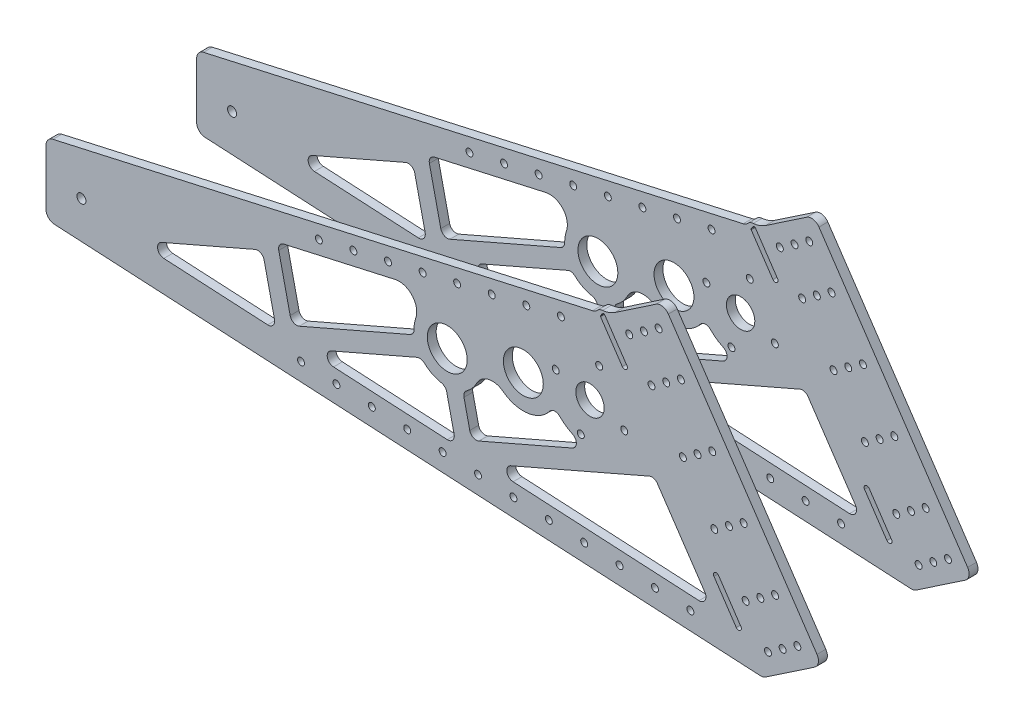
from build123d import *

# Parameters (mm, degrees)
BEARING_BLOCK_INTERFACE_PLATE_R   = 2.489199999999945
BEARING_BLOCK_INTERFACE_PLATE_R_2 = 2.4891999999999532
BEARING_BLOCK_INTERFACE_PLATE_R_3 = 2.4891999999998307
BOSS_EXTRUDE1_DEPTH               = 6.35
FILLET2_R                         = 6.35
PLATE_GB_R                        = 2.489199999999945
PLATE_GB_R_2                      = 2.4891999999998307
PLATE_GB_R_3                      = 14.287500000000026
PLATE_GB_R_4                      = 2.4891999999999532
PLATE_GB_R_5                      = 14.287500000000149
PLATE_GB_R_6                      = 2.4892000000000594
PLATE_GB_R_7                      = 10.159999999999924
PLATE_GB_R_8                      = 2.4891999999996024
BOSS_EXTRUDE2_DEPTH               = 6.35
FILLET1_R                         = 6.35
CUT_EXTRUDE1_REACH                = 774.478
TUBE_R                            = 3.2639000000000062
TUBE_R_2                          = 2.4891999999998307
TUBE_R_3                          = 2.4891999999999532
TUBE_R_4                          = 2.489199999999945
CUT_EXTRUDE2_REACH                = 774.478
FILLET3_R                         = 4.7625
FILLET4_R                         = 0.635


with BuildPart() as part:
    # bearing block interface plate → Boss-Extrude1 (new body)
    with BuildSketch(Plane.XY.offset(57.15000000000033)):
        Polygon((529.0514377657089, 336.1483946681548), (571.1665464508059, 364.5553941639975), (684.7945444360628, 196.0949594208139), (642.6794357509659, 167.6879599249711), align=None)
        with Locations((646.1064630479871, 185.31848697026268)):
            Circle(BEARING_BLOCK_INTERFACE_PLATE_R, mode=Mode.SUBTRACT)
        with Locations((656.635240219436, 192.42023684434122)):
            Circle(BEARING_BLOCK_INTERFACE_PLATE_R, mode=Mode.SUBTRACT)
        with Locations((667.164017390885, 199.5219867184198)):
            Circle(BEARING_BLOCK_INTERFACE_PLATE_R, mode=Mode.SUBTRACT)
        with Locations((567.7395191537848, 346.92486711870583)):
            Circle(BEARING_BLOCK_INTERFACE_PLATE_R_2, mode=Mode.SUBTRACT)
        with Locations((557.2107419823359, 339.8231172446273)):
            Circle(BEARING_BLOCK_INTERFACE_PLATE_R_2, mode=Mode.SUBTRACT)
        with Locations((546.6819648108869, 332.7213673705488)):
            Circle(BEARING_BLOCK_INTERFACE_PLATE_R_3, mode=Mode.SUBTRACT)
        with Locations((562.6609020275637, 309.03161873478854)):
            Circle(BEARING_BLOCK_INTERFACE_PLATE_R_3, mode=Mode.SUBTRACT)
        with Locations((573.189679199013, 316.133368608867)):
            Circle(BEARING_BLOCK_INTERFACE_PLATE_R_2, mode=Mode.SUBTRACT)
        with Locations((583.7184563704618, 323.2351184829455)):
            Circle(BEARING_BLOCK_INTERFACE_PLATE_R_2, mode=Mode.SUBTRACT)
        with Locations((606.2073309717106, 289.8939907733571)):
            Circle(BEARING_BLOCK_INTERFACE_PLATE_R_2, mode=Mode.SUBTRACT)
        with Locations((595.6785538002617, 282.7922408992787)):
            Circle(BEARING_BLOCK_INTERFACE_PLATE_R_2, mode=Mode.SUBTRACT)
        with Locations((585.1497766288124, 275.69049102520023)):
            Circle(BEARING_BLOCK_INTERFACE_PLATE_R_3, mode=Mode.SUBTRACT)
        with Locations((628.6962055729593, 256.55286306376865)):
            Circle(BEARING_BLOCK_INTERFACE_PLATE_R_2, mode=Mode.SUBTRACT)
        with Locations((618.1674284015103, 249.45111318969037)):
            Circle(BEARING_BLOCK_INTERFACE_PLATE_R_2, mode=Mode.SUBTRACT)
        with Locations((607.638651230061, 242.3493633156119)):
            Circle(BEARING_BLOCK_INTERFACE_PLATE_R_3, mode=Mode.SUBTRACT)
        with Locations((651.1850801742079, 223.21173535418063)):
            Circle(BEARING_BLOCK_INTERFACE_PLATE_R, mode=Mode.SUBTRACT)
        with Locations((640.656303002759, 216.1099854801021)):
            Circle(BEARING_BLOCK_INTERFACE_PLATE_R, mode=Mode.SUBTRACT)
        with Locations((630.1275258313098, 209.00823560602365)):
            Circle(BEARING_BLOCK_INTERFACE_PLATE_R_3, mode=Mode.SUBTRACT)
    extrude(amount=-BOSS_EXTRUDE1_DEPTH)

    # Fillet2
    fillet2_edges = [part.edges().sort_by_distance(p)[0] for p in [
        (642.6794357509659, 167.6879599249711, 53.975000000000335),
        (571.1665464508059, 364.5553941639975, 53.975000000000335),
        (529.0514377657089, 336.1483946681548, 53.975000000000335),
        (684.7945444360628, 196.0949594208139, 53.975000000000335),
    ]]
    fillet(fillet2_edges, radius=FILLET2_R)

    # plate+gb → Boss-Extrude2 (add)
    with BuildSketch(Plane.XY.offset(57.15000000000033)):
        with BuildLine():
            Line((128.73734233150986, 246.1260000000246), (128.73734233150986, 195.32600000002458))
            Line((128.73734233150986, 195.32600000002458), (642.6794357509659, 167.6879599249711))
            Line((642.6794357509659, 167.6879599249711), (684.7945444360628, 196.0949594208139))
            Line((684.7945444360628, 196.0949594208139), (571.1665464508058, 364.5553941639974))
            Line((571.1665464508058, 364.5553941639974), (536.5393493982891, 341.1990548376937))
            ThreePointArc((536.5393493982891, 341.19905483769367), (532.27553378646, 339.04547668364233), (527.6100125053204, 338.02032615200346))
            ThreePointArc((527.6100125053204, 338.02032615200335), (524.7494784778174, 337.0010093937264), (522.735638532723, 334.7281015091546))
            Line((522.735638532723, 334.7281015091547), (128.73734233150986, 246.1260000000246))
        make_face()
        with BuildLine():
            Line((541.7142246921655, 310.2218744185116), (525.976365604832, 333.55421002934514))
            ThreePointArc((525.9763656048323, 333.55421002934526), (526.9975356247328, 335.313412133839), (528.4731202472173, 336.7134943728115))
            ThreePointArc((528.4731202472174, 336.7134943728114), (528.7911345943266, 336.46047504727386), (529.0514377657092, 336.14839466815505))
            Line((529.0514377657091, 336.148394668155), (545.0303749823858, 312.45864603239465))
            ThreePointArc((545.0303749823858, 312.4586460323946), (544.490685644217, 309.6821850803432), (541.7142246921655, 310.22187441851156))
        make_face(mode=Mode.SUBTRACT)
        with Locations((646.1064630479871, 185.31848697026268)):
            Circle(PLATE_GB_R, mode=Mode.SUBTRACT)
        with BuildLine():
            ThreePointArc((607.4054110273914, 212.83068558260925), (607.94510036556, 215.60714653466047), (610.7215613176113, 215.06745719649211))
            Line((610.7215613176113, 215.0674571964921), (626.7004985342884, 191.37770856073158))
            ThreePointArc((626.7004985342884, 191.37770856073155), (626.1608091961198, 188.60124760867996), (623.3843482440682, 189.14093694684863))
            Line((623.3843482440683, 189.14093694684865), (607.4054110273914, 212.83068558260925))
        make_face(mode=Mode.SUBTRACT)
        with Locations((656.635240219436, 192.42023684434122)):
            Circle(PLATE_GB_R, mode=Mode.SUBTRACT)
        with Locations((667.164017390885, 199.5219867184198)):
            Circle(PLATE_GB_R, mode=Mode.SUBTRACT)
        with Locations((630.1275258313098, 209.00823560602365)):
            Circle(PLATE_GB_R_2, mode=Mode.SUBTRACT)
        with Locations((640.656303002759, 216.1099854801021)):
            Circle(PLATE_GB_R, mode=Mode.SUBTRACT)
        with Locations((416.28658066690326, 258.72124542384995)):
            Circle(PLATE_GB_R_3, mode=Mode.SUBTRACT)
        with Locations((511.9960146960638, 253.34148401228222)):
            Circle(PLATE_GB_R_4, mode=Mode.SUBTRACT)
        with Locations((651.1850801742079, 223.21173535418063)):
            Circle(PLATE_GB_R, mode=Mode.SUBTRACT)
        with Locations((607.638651230061, 242.3493633156119)):
            Circle(PLATE_GB_R_2, mode=Mode.SUBTRACT)
        with Locations((618.1674284015103, 249.45111318969037)):
            Circle(PLATE_GB_R_4, mode=Mode.SUBTRACT)
        with Locations((628.6962055729593, 256.55286306376865)):
            Circle(PLATE_GB_R_4, mode=Mode.SUBTRACT)
        with Locations((470.8050615222699, 270.9813288339667)):
            Circle(PLATE_GB_R_5, mode=Mode.SUBTRACT)
        with Locations((543.1045344294101, 271.3019962544207)):
            Circle(PLATE_GB_R_6, mode=Mode.SUBTRACT)
        with Locations((518.5700184416677, 277.8760000000246)):
            Circle(PLATE_GB_R_7, mode=Mode.SUBTRACT)
        with Locations((494.03550245392535, 284.45000374562846)):
            Circle(PLATE_GB_R_8, mode=Mode.SUBTRACT)
        with Locations((525.1440221872716, 302.410515987767)):
            Circle(PLATE_GB_R_2, mode=Mode.SUBTRACT)
        with Locations((585.1497766288124, 275.69049102520023)):
            Circle(PLATE_GB_R_2, mode=Mode.SUBTRACT)
        with Locations((595.6785538002617, 282.7922408992787)):
            Circle(PLATE_GB_R_4, mode=Mode.SUBTRACT)
        with Locations((606.2073309717106, 289.8939907733571)):
            Circle(PLATE_GB_R_4, mode=Mode.SUBTRACT)
        with Locations((562.6609020275637, 309.03161873478854)):
            Circle(PLATE_GB_R_2, mode=Mode.SUBTRACT)
        with Locations((573.189679199013, 316.133368608867)):
            Circle(PLATE_GB_R_4, mode=Mode.SUBTRACT)
        with Locations((583.7184563704618, 323.2351184829455)):
            Circle(PLATE_GB_R_4, mode=Mode.SUBTRACT)
        with Locations((546.6819648108869, 332.7213673705488)):
            Circle(PLATE_GB_R_2, mode=Mode.SUBTRACT)
        with Locations((557.2107419823359, 339.8231172446273)):
            Circle(PLATE_GB_R_4, mode=Mode.SUBTRACT)
        with Locations((567.7395191537848, 346.92486711870583)):
            Circle(PLATE_GB_R_4, mode=Mode.SUBTRACT)
    extrude(amount=-BOSS_EXTRUDE2_DEPTH)

    # Fillet1
    fillet1_edges = [part.edges().sort_by_distance(p)[0] for p in [
        (128.73734233150986, 195.32600000002458, 53.975000000000335),
        (128.73734233150986, 246.1260000000246, 53.975000000000335),
        (571.1665464508058, 364.5553941639974, 53.975000000000335),
        (642.6794357509659, 167.6879599249711, 53.975000000000335),
        (684.7945444360628, 196.0949594208139, 53.975000000000335),
        (522.735638532723, 334.72810150915467, 53.975000000000335),
    ]]
    fillet(fillet1_edges, radius=FILLET1_R)

    # tube → Cut-Extrude1 (cut, up to next)
    with BuildSketch(Plane.XY.offset(57.15000000000033), mode=Mode.PRIVATE) as cut_extrude1_sk1:
        with Locations((154.13734233150987, 220.7260000000245)):
            Circle(TUBE_R)
    cut_extrude1_tool1 = extrude(cut_extrude1_sk1.sketch, amount=-CUT_EXTRUDE1_REACH, mode=Mode.PRIVATE) & part.part
    # tube → Cut-Extrude1 (cut, up to next)
    with BuildSketch(Plane.XY.offset(57.15000000000033), mode=Mode.PRIVATE) as cut_extrude1_sk2:
        with Locations((497.7285010763347, 319.34163846208315)):
            Circle(TUBE_R_2)
    cut_extrude1_tool2 = extrude(cut_extrude1_sk2.sketch, amount=-CUT_EXTRUDE1_REACH, mode=Mode.PRIVATE) & part.part
    # tube → Cut-Extrude1 (cut, up to next)
    with BuildSketch(Plane.XY.offset(57.15000000000033), mode=Mode.PRIVATE) as cut_extrude1_sk3:
        with Locations((472.9473734148044, 313.76887327566646)):
            Circle(TUBE_R_3)
    cut_extrude1_tool3 = extrude(cut_extrude1_sk3.sketch, amount=-CUT_EXTRUDE1_REACH, mode=Mode.PRIVATE) & part.part
    # tube → Cut-Extrude1 (cut, up to next)
    with BuildSketch(Plane.XY.offset(57.15000000000033), mode=Mode.PRIVATE) as cut_extrude1_sk4:
        with Locations((448.16624575327415, 308.1961080892497)):
            Circle(TUBE_R_3)
    cut_extrude1_tool4 = extrude(cut_extrude1_sk4.sketch, amount=-CUT_EXTRUDE1_REACH, mode=Mode.PRIVATE) & part.part
    # tube → Cut-Extrude1 (cut, up to next)
    with BuildSketch(Plane.XY.offset(57.15000000000033), mode=Mode.PRIVATE) as cut_extrude1_sk5:
        with Locations((423.38511809174383, 302.62334290283303)):
            Circle(TUBE_R_3)
    cut_extrude1_tool5 = extrude(cut_extrude1_sk5.sketch, amount=-CUT_EXTRUDE1_REACH, mode=Mode.PRIVATE) & part.part
    # tube → Cut-Extrude1 (cut, up to next)
    with BuildSketch(Plane.XY.offset(57.15000000000033), mode=Mode.PRIVATE) as cut_extrude1_sk6:
        with Locations((398.60399043021357, 297.05057771641634)):
            Circle(TUBE_R_3)
    cut_extrude1_tool6 = extrude(cut_extrude1_sk6.sketch, amount=-CUT_EXTRUDE1_REACH, mode=Mode.PRIVATE) & part.part
    # tube → Cut-Extrude1 (cut, up to next)
    with BuildSketch(Plane.XY.offset(57.15000000000033), mode=Mode.PRIVATE) as cut_extrude1_sk7:
        with Locations((373.82286276868325, 291.47781252999965)):
            Circle(TUBE_R_2)
    cut_extrude1_tool7 = extrude(cut_extrude1_sk7.sketch, amount=-CUT_EXTRUDE1_REACH, mode=Mode.PRIVATE) & part.part
    # tube → Cut-Extrude1 (cut, up to next)
    with BuildSketch(Plane.XY.offset(57.15000000000033), mode=Mode.PRIVATE) as cut_extrude1_sk8:
        with Locations((590.5082808024525, 183.21189582536667)):
            Circle(TUBE_R_4)
    cut_extrude1_tool8 = extrude(cut_extrude1_sk8.sketch, amount=-CUT_EXTRUDE1_REACH, mode=Mode.PRIVATE) & part.part
    # tube → Cut-Extrude1 (cut, up to next)
    with BuildSketch(Plane.XY.offset(57.15000000000033), mode=Mode.PRIVATE) as cut_extrude1_sk9:
        with Locations((565.144928704245, 184.5758497624026)):
            Circle(TUBE_R_4)
    cut_extrude1_tool9 = extrude(cut_extrude1_sk9.sketch, amount=-CUT_EXTRUDE1_REACH, mode=Mode.PRIVATE) & part.part
    # tube → Cut-Extrude1 (cut, up to next)
    with BuildSketch(Plane.XY.offset(57.15000000000033), mode=Mode.PRIVATE) as cut_extrude1_sk10:
        with Locations((539.7815766060377, 185.93980369943853)):
            Circle(TUBE_R_4)
    cut_extrude1_tool10 = extrude(cut_extrude1_sk10.sketch, amount=-CUT_EXTRUDE1_REACH, mode=Mode.PRIVATE) & part.part
    # tube → Cut-Extrude1 (cut, up to next)
    with BuildSketch(Plane.XY.offset(57.15000000000033), mode=Mode.PRIVATE) as cut_extrude1_sk11:
        with Locations((514.4182245078301, 187.30375763647444)):
            Circle(TUBE_R_4)
    cut_extrude1_tool11 = extrude(cut_extrude1_sk11.sketch, amount=-CUT_EXTRUDE1_REACH, mode=Mode.PRIVATE) & part.part
    # tube → Cut-Extrude1 (cut, up to next)
    with BuildSketch(Plane.XY.offset(57.15000000000033), mode=Mode.PRIVATE) as cut_extrude1_sk12:
        with Locations((489.05487240962265, 188.66771157351036)):
            Circle(TUBE_R_4)
    cut_extrude1_tool12 = extrude(cut_extrude1_sk12.sketch, amount=-CUT_EXTRUDE1_REACH, mode=Mode.PRIVATE) & part.part
    # tube → Cut-Extrude1 (cut, up to next)
    with BuildSketch(Plane.XY.offset(57.15000000000033), mode=Mode.PRIVATE) as cut_extrude1_sk13:
        with Locations((463.6915203114152, 190.03166551054628)):
            Circle(TUBE_R_4)
    cut_extrude1_tool13 = extrude(cut_extrude1_sk13.sketch, amount=-CUT_EXTRUDE1_REACH, mode=Mode.PRIVATE) & part.part
    # tube → Cut-Extrude1 (cut, up to next)
    with BuildSketch(Plane.XY.offset(57.15000000000033), mode=Mode.PRIVATE) as cut_extrude1_sk14:
        with Locations((438.32816821320773, 191.39561944758222)):
            Circle(TUBE_R_4)
    cut_extrude1_tool14 = extrude(cut_extrude1_sk14.sketch, amount=-CUT_EXTRUDE1_REACH, mode=Mode.PRIVATE) & part.part
    # tube → Cut-Extrude1 (cut, up to next)
    with BuildSketch(Plane.XY.offset(57.15000000000033), mode=Mode.PRIVATE) as cut_extrude1_sk15:
        with Locations((412.96481611500025, 192.75957338461814)):
            Circle(TUBE_R_4)
    cut_extrude1_tool15 = extrude(cut_extrude1_sk15.sketch, amount=-CUT_EXTRUDE1_REACH, mode=Mode.PRIVATE) & part.part
    # tube → Cut-Extrude1 (cut, up to next)
    with BuildSketch(Plane.XY.offset(57.15000000000033), mode=Mode.PRIVATE) as cut_extrude1_sk16:
        with Locations((387.6014640167928, 194.12352732165405)):
            Circle(TUBE_R_4)
    cut_extrude1_tool16 = extrude(cut_extrude1_sk16.sketch, amount=-CUT_EXTRUDE1_REACH, mode=Mode.PRIVATE) & part.part
    # tube → Cut-Extrude1 (cut, up to next)
    with BuildSketch(Plane.XY.offset(57.15000000000033), mode=Mode.PRIVATE) as cut_extrude1_sk17:
        with Locations((362.23811191858533, 195.48748125868997)):
            Circle(TUBE_R_4)
    cut_extrude1_tool17 = extrude(cut_extrude1_sk17.sketch, amount=-CUT_EXTRUDE1_REACH, mode=Mode.PRIVATE) & part.part
    # tube → Cut-Extrude1 (cut, up to next)
    with BuildSketch(Plane.XY.offset(57.15000000000033), mode=Mode.PRIVATE) as cut_extrude1_sk18:
        with Locations((336.87475982037785, 196.8514351957259)):
            Circle(TUBE_R_4)
    cut_extrude1_tool18 = extrude(cut_extrude1_sk18.sketch, amount=-CUT_EXTRUDE1_REACH, mode=Mode.PRIVATE) & part.part
    # tube → Cut-Extrude1 (cut, up to next)
    with BuildSketch(Plane.XY.offset(57.15000000000033), mode=Mode.PRIVATE) as cut_extrude1_sk19:
        with Locations((311.5114077221704, 198.21538913276183)):
            Circle(TUBE_R_4)
    cut_extrude1_tool19 = extrude(cut_extrude1_sk19.sketch, amount=-CUT_EXTRUDE1_REACH, mode=Mode.PRIVATE) & part.part
    # tube → Cut-Extrude1 (cut, up to next)
    with BuildSketch(Plane.XY.offset(57.15000000000033), mode=Mode.PRIVATE) as cut_extrude1_sk20:
        with Locations((349.04173510715304, 285.90504734358296)):
            Circle(TUBE_R_2)
    cut_extrude1_tool20 = extrude(cut_extrude1_sk20.sketch, amount=-CUT_EXTRUDE1_REACH, mode=Mode.PRIVATE) & part.part
    # tube → Cut-Extrude1 (cut, up to next)
    with BuildSketch(Plane.XY.offset(57.15000000000033), mode=Mode.PRIVATE) as cut_extrude1_sk21:
        with Locations((324.2606074456227, 280.3322821571662)):
            Circle(TUBE_R_3)
    cut_extrude1_tool21 = extrude(cut_extrude1_sk21.sketch, amount=-CUT_EXTRUDE1_REACH, mode=Mode.PRIVATE) & part.part
    add(cut_extrude1_tool1.solids().sort_by_distance((154.137342, 220.726, 57.15))[0], mode=Mode.SUBTRACT)
    add(cut_extrude1_tool2.solids().sort_by_distance((497.728501, 319.341638, 57.15))[0], mode=Mode.SUBTRACT)
    add(cut_extrude1_tool3.solids().sort_by_distance((472.947373, 313.768873, 57.15))[0], mode=Mode.SUBTRACT)
    add(cut_extrude1_tool4.solids().sort_by_distance((448.166246, 308.196108, 57.15))[0], mode=Mode.SUBTRACT)
    add(cut_extrude1_tool5.solids().sort_by_distance((423.385118, 302.623343, 57.15))[0], mode=Mode.SUBTRACT)
    add(cut_extrude1_tool6.solids().sort_by_distance((398.60399, 297.050578, 57.15))[0], mode=Mode.SUBTRACT)
    add(cut_extrude1_tool7.solids().sort_by_distance((373.822863, 291.477813, 57.15))[0], mode=Mode.SUBTRACT)
    add(cut_extrude1_tool8.solids().sort_by_distance((590.508281, 183.211896, 57.15))[0], mode=Mode.SUBTRACT)
    add(cut_extrude1_tool9.solids().sort_by_distance((565.144929, 184.57585, 57.15))[0], mode=Mode.SUBTRACT)
    add(cut_extrude1_tool10.solids().sort_by_distance((539.781577, 185.939804, 57.15))[0], mode=Mode.SUBTRACT)
    add(cut_extrude1_tool11.solids().sort_by_distance((514.418225, 187.303758, 57.15))[0], mode=Mode.SUBTRACT)
    add(cut_extrude1_tool12.solids().sort_by_distance((489.054872, 188.667712, 57.15))[0], mode=Mode.SUBTRACT)
    add(cut_extrude1_tool13.solids().sort_by_distance((463.69152, 190.031666, 57.15))[0], mode=Mode.SUBTRACT)
    add(cut_extrude1_tool14.solids().sort_by_distance((438.328168, 191.395619, 57.15))[0], mode=Mode.SUBTRACT)
    add(cut_extrude1_tool15.solids().sort_by_distance((412.964816, 192.759573, 57.15))[0], mode=Mode.SUBTRACT)
    add(cut_extrude1_tool16.solids().sort_by_distance((387.601464, 194.123527, 57.15))[0], mode=Mode.SUBTRACT)
    add(cut_extrude1_tool17.solids().sort_by_distance((362.238112, 195.487481, 57.15))[0], mode=Mode.SUBTRACT)
    add(cut_extrude1_tool18.solids().sort_by_distance((336.87476, 196.851435, 57.15))[0], mode=Mode.SUBTRACT)
    add(cut_extrude1_tool19.solids().sort_by_distance((311.511408, 198.215389, 57.15))[0], mode=Mode.SUBTRACT)
    add(cut_extrude1_tool20.solids().sort_by_distance((349.041735, 285.905047, 57.15))[0], mode=Mode.SUBTRACT)
    add(cut_extrude1_tool21.solids().sort_by_distance((324.260607, 280.332282, 57.15))[0], mode=Mode.SUBTRACT)

    # Sketch20 → Cut-Extrude2 (cut, up to next)
    with BuildSketch(Plane.XY.offset(57.15000000000033), mode=Mode.PRIVATE) as cut_extrude2_sk1:
        Polygon((283.7782182408136, 253.59394234449184), (193.02712039136657, 214.1258298591775), (293.87334152601755, 208.70266655571493), align=None)
    cut_extrude2_tool1 = extrude(cut_extrude2_sk1.sketch, amount=-CUT_EXTRUDE2_REACH, mode=Mode.PRIVATE) & part.part
    # Sketch20 → Cut-Extrude2 (cut, up to next)
    with BuildSketch(Plane.XY.offset(57.15000000000033), mode=Mode.PRIVATE) as cut_extrude2_sk2:
        with BuildLine():
            Line((397.7730730126499, 243.7450913586069), (314.6314269698162, 207.58636803741302))
            Line((314.6314269698162, 207.58636803741308), (422.5826597553713, 201.78112161747538))
            Line((422.58265975537137, 201.7811216174754), (415.1265819839163, 234.93701620982114))
            ThreePointArc((415.126581983916, 234.93701620982102), (405.5089529197121, 237.48735985401194), (397.77307301264995, 243.74509135860666))
        make_face()
    cut_extrude2_tool2 = extrude(cut_extrude2_sk2.sketch, amount=-CUT_EXTRUDE2_REACH, mode=Mode.PRIVATE) & part.part
    # Sketch20 → Cut-Extrude2 (cut, up to next)
    with BuildSketch(Plane.XY.offset(57.15000000000033), mode=Mode.PRIVATE) as cut_extrude2_sk3:
        with BuildLine():
            Line((304.9718820421919, 217.2344544602027), (392.70805195930586, 255.3913595046347))
            ThreePointArc((392.7080519593054, 255.39135950463523), (392.57852746394303, 260.94910753260035), (393.741172300006, 266.38542951740084))
            ThreePointArc((393.7411723000059, 266.38542951740084), (391.16240743211694, 278.96260089462623), (378.93057191111905, 282.86355819805976))
            Line((378.93057191111905, 282.8635581980597), (294.4837853667419, 263.87321528118673))
            Line((294.483785366742, 263.87321528118673), (304.9718820421919, 217.2344544602027))
        make_face()
    cut_extrude2_tool3 = extrude(cut_extrude2_sk3.sketch, amount=-CUT_EXTRUDE2_REACH, mode=Mode.PRIVATE) & part.part
    # Sketch20 → Cut-Extrude2 (cut, up to next)
    with BuildSketch(Plane.XY.offset(57.15000000000033), mode=Mode.PRIVATE) as cut_extrude2_sk4:
        Polygon((564.6938350728718, 253.44189704181008), (443.3407451991701, 200.66482309917347), (606.1997655838906, 191.9068245043722), align=None)
    cut_extrude2_tool4 = extrude(cut_extrude2_sk4.sketch, amount=-CUT_EXTRUDE2_REACH, mode=Mode.PRIVATE) & part.part
    # Sketch20 → Cut-Extrude2 (cut, up to next)
    with BuildSketch(Plane.XY.offset(57.15000000000033), mode=Mode.PRIVATE) as cut_extrude2_sk5:
        with BuildLine():
            ThreePointArc((437.4277117876691, 247.7627906429703), (433.232938002764, 241.99234440509446), (427.5171458146811, 237.7233988030291))
            Line((427.51714581468167, 237.72339880302906), (433.6812002715457, 210.31290952196312))
            Line((433.6812002715457, 210.31290952196312), (519.7296081727479, 247.7357983101625))
            ThreePointArc((519.7296081727479, 247.73579831016238), (504.36792965000797, 251.2662822224191), (492.8846159595747, 262.0634573334294))
            ThreePointArc((492.88461595957466, 262.0634573334294), (477.11936489850655, 248.0212606911487), (456.39066165040543, 252.02716748127182))
            ThreePointArc((456.39066165040543, 252.0271674812718), (445.9165991255359, 254.30884525726637), (437.4277117876691, 247.7627906429703))
        make_face()
    cut_extrude2_tool5 = extrude(cut_extrude2_sk5.sketch, amount=-CUT_EXTRUDE2_REACH, mode=Mode.PRIVATE) & part.part
    add(cut_extrude2_tool1.solids().sort_by_distance((256.892893, 225.474146, 57.15))[0], mode=Mode.SUBTRACT)
    add(cut_extrude2_tool2.solids().sort_by_distance((381.543889, 218.429138, 57.15))[0], mode=Mode.SUBTRACT)
    add(cut_extrude2_tool3.solids().sort_by_distance((342.159835, 254.458367, 57.15))[0], mode=Mode.SUBTRACT)
    add(cut_extrude2_tool4.solids().sort_by_distance((538.078115, 215.337848, 57.15))[0], mode=Mode.SUBTRACT)
    add(cut_extrude2_tool5.solids().sort_by_distance((463.243993, 237.371256, 57.15))[0], mode=Mode.SUBTRACT)

    # Fillet3
    fillet3_edges = [part.edges().sort_by_distance(p)[0] for p in [
        (392.70805195930564, 255.39135950463498, 53.975000000000335),
        (304.9718820421919, 217.2344544602027, 53.975000000000335),
        (294.4837853667419, 263.87321528118673, 53.975000000000335),
        (492.8846159595747, 262.0634573334294, 53.975000000000335),
        (519.7296081727479, 247.73579831016247, 53.975000000000335),
        (433.6812002715457, 210.31290952196312, 53.975000000000335),
        (427.5171458146814, 237.72339880302908, 53.975000000000335),
        (564.6938350728717, 253.44189704181005, 53.975000000000335),
        (606.1997655838906, 191.9068245043722, 53.975000000000335),
        (443.3407451991701, 200.66482309917347, 53.975000000000335),
        (415.12658198391614, 234.93701620982108, 53.975000000000335),
        (422.5826597553713, 201.78112161747538, 53.975000000000335),
        (314.6314269698162, 207.58636803741305, 53.975000000000335),
        (397.7730730126499, 243.74509135860677, 53.975000000000335),
        (283.7782182408136, 253.59394234449184, 53.975000000000335),
        (293.8733415260176, 208.70266655571493, 53.975000000000335),
        (193.02712039136657, 214.12582985917754, 53.975000000000335),
    ]]
    fillet(fillet3_edges, radius=FILLET3_R)

    # Fillet4
    fillet4_edges = [part.edges().sort_by_distance(p)[0] for p in [
        (528.4731202472174, 336.71349437281145, 53.975000000000335),
        (525.9763656048322, 333.5542100293452, 53.975000000000335),
    ]]
    fillet(fillet4_edges, radius=FILLET4_R)


with BuildPart() as body_2:
    # Mirror1: mirrored copy
    add(part.part.mirror(Plane.XY))


solid = Compound([part.part, body_2.part])
